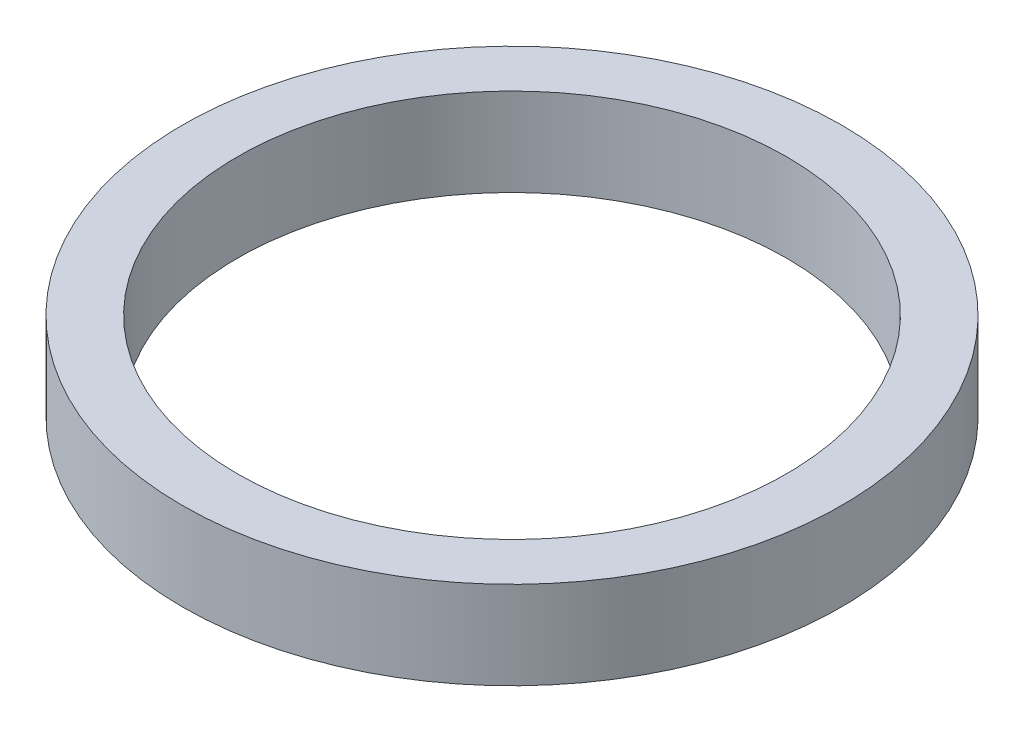
from build123d import *

# Parameters (mm, degrees)
SKETCH1_R           = 60
BOSS_EXTRUDE1_DEPTH = 16
SKETCH2_R           = 50
CUT_EXTRUDE1_DEPTH  = 87.34813258


with BuildPart() as part:
    # Sketch1 → Boss-Extrude1 (new body)
    with BuildSketch(Plane(origin=(0, 0, 0), x_dir=(1, 0, 0), z_dir=(0, 1, 0))):
        Circle(SKETCH1_R)
    extrude(amount=BOSS_EXTRUDE1_DEPTH)

    # Sketch2 → Cut-Extrude1 (cut, through all)
    with BuildSketch(Plane(origin=(0, 0, 0), x_dir=(1, 0, 0), z_dir=(0, 1, 0))):
        Circle(SKETCH2_R)
    extrude(amount=CUT_EXTRUDE1_DEPTH, mode=Mode.SUBTRACT)


solid = part.part
